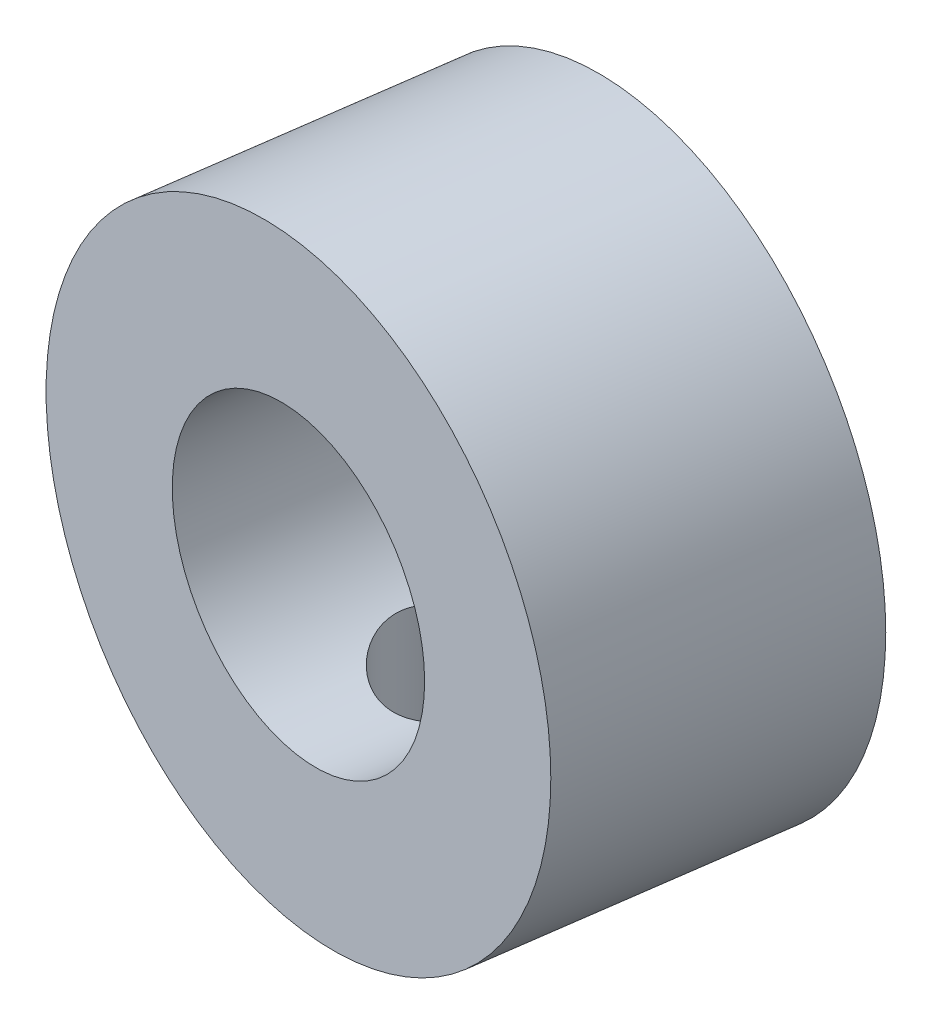
from build123d import *

# Parameters (mm, degrees)
SKETCH1_W                 = 6.35
SKETCH1_H                 = 3.175
F_6_32_TAPPED_HOLE1_D     = 2.7051
F_6_32_TAPPED_HOLE1_DEPTH = 6.35
F_6_32_TAPPED_HOLE1_TIP   = 0.81269403


with BuildPart() as part:
    # Sketch1 → Revolve1 (revolve)
    with BuildSketch(Plane(origin=(-29.958526336, -0.005469007, 37.92245832), x_dir=(0.13925483139909497, 0, -0.9902565788380351), z_dir=(0.9894272351965835, -0.04091828655590667, 0.13913820494951587))):
        with Locations((53.390881452, -15.89840516)):
            Rectangle(SKETCH1_W, SKETCH1_H)
    revolve(axis=Axis((-23.416944681, -11.132047804, -11.867601806), (0.13925483139909542, 0, -0.9902565788380351)))

    # #6-32 Tapped Hole1
    with Locations(Plane(origin=(0, -17.482047804, 0), x_dir=(-1, 0, 0), z_dir=(0, -1, 0))):
        with Locations((23.232110067, 15.047849183)):
            Hole(F_6_32_TAPPED_HOLE1_D / 2, depth=F_6_32_TAPPED_HOLE1_DEPTH)
            with Locations((0, 0, -(F_6_32_TAPPED_HOLE1_DEPTH + F_6_32_TAPPED_HOLE1_TIP / 2))):  # 118° drill point
                Cone(0, F_6_32_TAPPED_HOLE1_D / 2, F_6_32_TAPPED_HOLE1_TIP, mode=Mode.SUBTRACT)


solid = part.part
